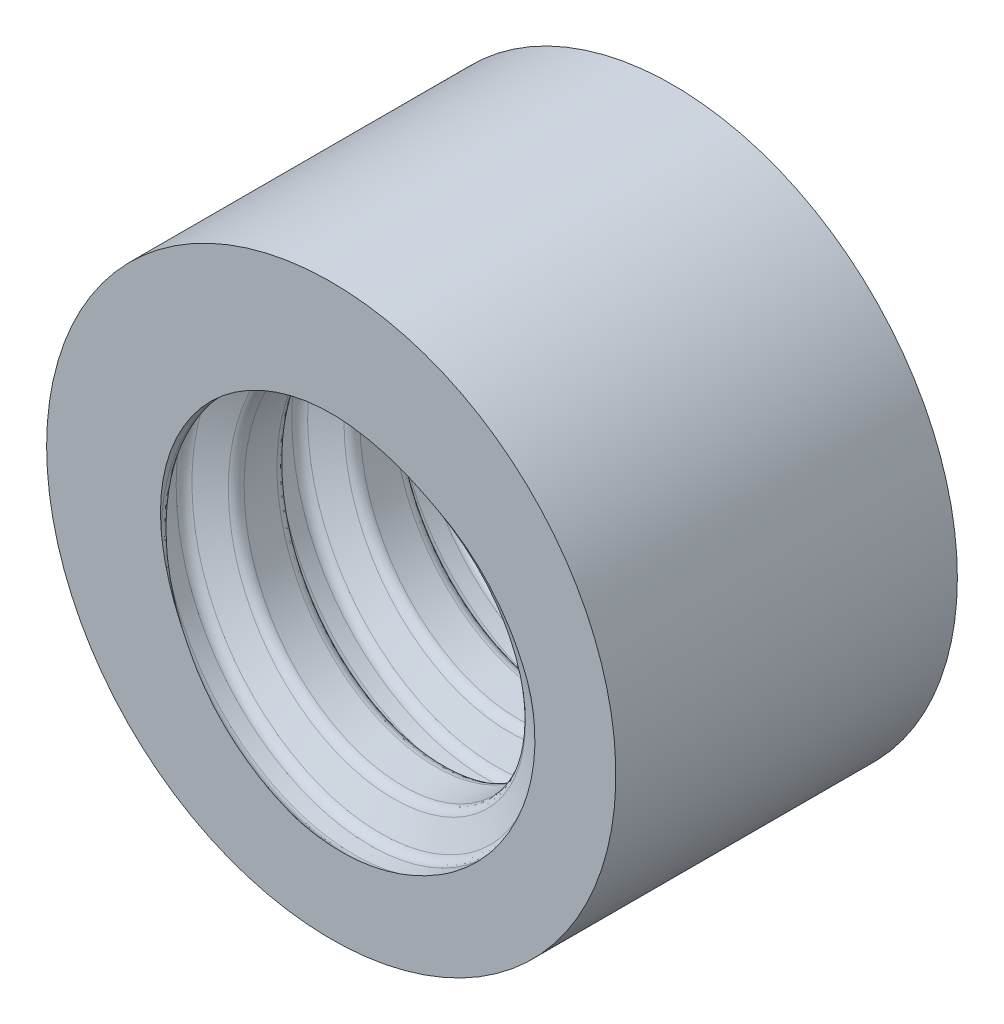
from build123d import *

# Parameters (mm, degrees)
SKETCH1_R               = 12.5
SKETCH1_R_2             = 7.5
BOSS_EXTRUDE1_DEPTH     = 20
THREAD1_PITCH           = 5.08
CUT_EXTRUDE1_DEPTH      = 27.692695799
CUT_EXTRUDE1_DEPTH_BACK = 27.692695799
SKETCH6_W               = 25
SKETCH6_H               = 10


with BuildPart() as part:
    # Sketch1 → Boss-Extrude1 (new body)
    with BuildSketch(Plane.XY):
        Circle(SKETCH1_R)
        Circle(SKETCH1_R_2, mode=Mode.SUBTRACT)
    extrude(amount=BOSS_EXTRUDE1_DEPTH)

    # Thread1: the profile of Thread Profile1 profile screwed along a right-hand helix of 3.937008 turns, 12 arcs to a turn; built about Z, then put on its axis
    thread1_z = Axis((0, 0, 0), (0, 0, 1))
    thread1_corners = [(7.4997, 0, 0), (7.4997, 0, 3.634587873), (7.5, 0, 3.634587873), (7.754, 0, 3.194646968), (8.77, 0, 2.608059095), (9.024, 0, 2.16811819), (9.024, 0, 1.466469684), (8.77, 0, 1.026528779), (7.754, 0, 0.439940905), (7.5, 0, 0)]
    with BuildLine(mode=Mode.PRIVATE) as thread1_profile:
        Line(thread1_corners[0], thread1_corners[1])
        Line(thread1_corners[3], thread1_corners[4])
        Line(thread1_corners[5], thread1_corners[6])
        Line(thread1_corners[7], thread1_corners[8])
        Line(thread1_corners[9], thread1_corners[0])
        Line(thread1_corners[2], thread1_corners[1])
        ThreePointArc((7.5, 0, 3.634587873), (7.568059095, 0, 3.380587873), (7.754, 0, 3.194646968))
        ThreePointArc((8.77, 0, 2.608059095), (8.955940905, 0, 2.42211819), (9.024, 0, 2.16811819))
        ThreePointArc((9.024, 0, 1.466469684), (8.955940905, 0, 1.212469684), (8.77, 0, 1.026528779))
        ThreePointArc((7.754, 0, 0.439940905), (7.568059095, 0, 0.254), (7.5, 0, 0))
    thread1_cap = Face(thread1_profile.wire())
    thread1_arcs = [((7.5, 0, 3.634587873), (7.5, 0, 3.341293937), (7.754, 0, 3.194646968), (1, 0.866025403784437, 1)), ((8.77, 0, 2.608059095), (9.024, 0, 2.461412127), (9.024, 0, 2.16811819), (1, 0.8660254037844386, 1)), ((9.024, 0, 1.466469684), (9.024, 0, 1.173175747), (8.77, 0, 1.026528779), (1, 0.8660254037844376, 1)), ((7.754, 0, 0.439940905), (7.5, 0, 0.293293937), (7.5, 0, 0), (1, 0.8660254037844369, 1))]  # start, shoulder, end, weights
    thread1_turn_angles = [0, 15, 30, 45, 60, 75, 90, 105, 120, 135, 150, 165, 180, 195, 210, 225, 240, 255, 270, 285, 300, 315, 330, 345, 360]
    thread1_turn_weights = [1, 0.9659258262890683, 1, 0.9659258262890683, 1, 0.9659258262890683, 1, 0.9659258262890683, 1, 0.9659258262890683, 1, 0.9659258262890683, 1, 0.9659258262890683, 1, 0.9659258262890683, 1, 0.9659258262890683, 1, 0.9659258262890683, 1, 0.9659258262890683, 1, 0.9659258262890683, 1]
    thread1_turn_rails = [Edge.make_bspline([Vector(p[0], p[1], 0).rotate(thread1_z, thread1_turn_angles[k]) / thread1_turn_weights[k] + Vector(0, 0, p[2] + THREAD1_PITCH * thread1_turn_angles[k] / 360) for k in range(25)], [0, 0, 0, 1, 1, 2, 2, 3, 3, 4, 4, 5, 5, 6, 6, 7, 7, 8, 8, 9, 9, 10, 10, 11, 11, 12, 12, 12], 2, thread1_turn_weights) for p in thread1_corners]
    thread1_turn_sides = [*[Face.make_surface_from_curves(thread1_turn_rails[p[0]], thread1_turn_rails[p[1]]) for p in [(0, 1), (3, 4), (5, 6), (7, 8), (9, 0), (2, 1)]], *[Face.make_bezier_surface([[Vector(p[j][0], p[j][1], 0).rotate(thread1_z, thread1_turn_angles[2 * i + k]) / thread1_turn_weights[2 * i + k] + Vector(0, 0, p[j][2] + THREAD1_PITCH * thread1_turn_angles[2 * i + k] / 360) for k in range(3)] for j in range(3)], [[p[3][j] * thread1_turn_weights[2 * i + k] for k in range(3)] for j in range(3)]) for p in thread1_arcs for i in range(12)]]
    thread1_last_angles = [1080, 1095, 1110, 1125, 1140, 1155, 1170, 1185, 1200, 1215, 1230, 1245, 1260, 1275, 1290, 1305, 1320, 1335, 1350, 1365, 1380, 1395, 1410, 1413.661417323, 1417.322834646]
    thread1_last_weights = [1, 0.9659258262890683, 1, 0.9659258262890683, 1, 0.9659258262890683, 1, 0.9659258262890683, 1, 0.9659258262890683, 1, 0.9659258262890683, 1, 0.9659258262890683, 1, 0.9659258262890683, 1, 0.9659258262890683, 1, 0.9659258262890683, 1, 0.9659258262890683, 1, 0.9979588477288831, 1]
    thread1_last_rails = [Edge.make_bspline([Vector(p[0], p[1], 0).rotate(thread1_z, thread1_last_angles[k]) / thread1_last_weights[k] + Vector(0, 0, p[2] + THREAD1_PITCH * thread1_last_angles[k] / 360) for k in range(25)], [0, 0, 0, 1, 1, 2, 2, 3, 3, 4, 4, 5, 5, 6, 6, 7, 7, 8, 8, 9, 9, 10, 10, 11, 11, 12, 12, 12], 2, thread1_last_weights) for p in thread1_corners]
    thread1_last_sides = [*[Face.make_surface_from_curves(thread1_last_rails[p[0]], thread1_last_rails[p[1]]) for p in [(0, 1), (3, 4), (5, 6), (7, 8), (9, 0), (2, 1)]], *[Face.make_bezier_surface([[Vector(p[j][0], p[j][1], 0).rotate(thread1_z, thread1_last_angles[2 * i + k]) / thread1_last_weights[2 * i + k] + Vector(0, 0, p[j][2] + THREAD1_PITCH * thread1_last_angles[2 * i + k] / 360) for k in range(3)] for j in range(3)], [[p[3][j] * thread1_last_weights[2 * i + k] for k in range(3)] for j in range(3)]) for p in thread1_arcs for i in range(12)]]
    thread1 = Plane(origin=(0, 0, 20), x_dir=(-1, 0, 0), z_dir=(0, 0, -1)) * Solid(Shell([*[p.moved(Location((0, 0, THREAD1_PITCH * i))) for i in range(3) for p in thread1_turn_sides], *thread1_last_sides, thread1_cap, thread1_cap.rotate(thread1_z, 1417.322834646).moved(Location((0, 0, THREAD1_PITCH * 1417.322834646 / 360)))]))
    add(thread1, mode=Mode.SUBTRACT)

    # Sketch6 → Cut-Extrude1 (cut, two sides: drawn at the far end of the back side and taken through both)
    with BuildSketch(Plane(origin=(0, 0, 0), x_dir=(1, 0, 0), z_dir=(0, 1, 0)).offset(-CUT_EXTRUDE1_DEPTH_BACK)):
        with Locations((0, -20)):
            Rectangle(SKETCH6_W, SKETCH6_H)
    extrude(amount=CUT_EXTRUDE1_DEPTH + CUT_EXTRUDE1_DEPTH_BACK, mode=Mode.SUBTRACT)


solid = part.part
